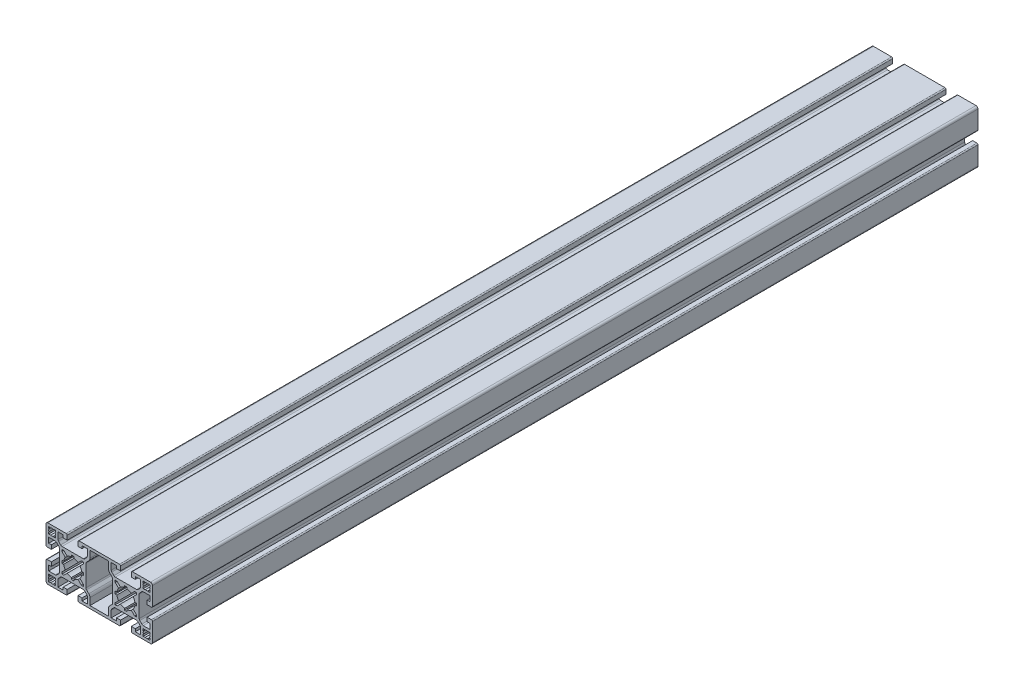
from build123d import *

# Parameters (mm, degrees)
RESSALTO_EXTRUS_O1_DEPTH = 310
SKETCH1_R                = 3
CUT_EXTRUDE1_DEPTH       = 316.119025132


with BuildPart() as part:
    # Esboço1 → Ressalto-extrusão1 (new, symmetric)
    with BuildSketch(Plane.XY):
        with BuildLine():
            Line((-38.5, 20), (-24.85, 20))
            ThreePointArc((-24.85, 20), (-24.284314575, 19.765685425), (-24.05, 19.2))
            Line((-24.05, 19.2), (-24.05, 16))
            Line((-24.05, 16), (-27.05, 16))
            Line((-27.05, 16), (-27.05, 18))
            Line((-27.05, 18), (-31, 18))
            Line((-31, 18), (-31, 13.035533906))
            ThreePointArc((-31, 13.035533906), (-30.885819299, 12.461508757), (-30.560660172, 11.974873734))
            Line((-30.560660172, 11.974873734), (-29.025126266, 10.439339828))
            ThreePointArc((-29.025126266, 10.439339828), (-28.538491243, 10.114180701), (-27.964466094, 10))
            Line((-27.964466094, 10), (-12.035533906, 10))
            ThreePointArc((-12.035533906, 10), (-11.461508757, 10.114180701), (-10.974873734, 10.439339828))
            Line((-10.974873734, 10.439339828), (-9.439339828, 11.974873734))
            ThreePointArc((-9.439339828, 11.974873734), (-9.114180701, 12.461508757), (-9, 13.035533906))
            Line((-9, 13.035533906), (-9, 18))
            Line((-9, 18), (-12.95, 18))
            Line((-12.95, 18), (-12.95, 16))
            Line((-12.95, 16), (-15.95, 16))
            Line((-15.95, 16), (-15.95, 19.2))
            ThreePointArc((-15.95, 19.2), (-15.715685425, 19.765685425), (-15.15, 20))
            Line((-15.15, 20), (15.15, 20))
            ThreePointArc((15.15, 20), (15.715685425, 19.765685425), (15.95, 19.2))
            Line((15.95, 19.2), (15.95, 16))
            Line((15.95, 16), (12.95, 16))
            Line((12.95, 16), (12.95, 18))
            Line((12.95, 18), (9, 18))
            Line((9, 18), (9, 13.035533906))
            ThreePointArc((9, 13.035533906), (9.114180701, 12.461508757), (9.439339828, 11.974873734))
            Line((9.439339828, 11.974873734), (10.974873734, 10.439339828))
            ThreePointArc((10.974873734, 10.439339828), (11.461508757, 10.114180701), (12.035533906, 10))
            Line((12.035533906, 10), (27.964466094, 10))
            ThreePointArc((27.964466094, 10), (28.538491243, 10.114180701), (29.025126266, 10.439339828))
            Line((29.025126266, 10.439339828), (30.560660172, 11.974873734))
            ThreePointArc((30.560660172, 11.974873734), (30.885819299, 12.461508757), (31, 13.035533906))
            Line((31, 13.035533906), (31, 18))
            Line((31, 18), (27.05, 18))
            Line((27.05, 18), (27.05, 16))
            Line((27.05, 16), (24.05, 16))
            Line((24.05, 16), (24.05, 19.2))
            ThreePointArc((24.05, 19.2), (24.284314575, 19.765685425), (24.85, 20))
            Line((24.85, 20), (38.5, 20))
            ThreePointArc((38.5, 20), (39.560660172, 19.560660172), (40, 18.5))
            Line((40, 18.5), (40, 4.85))
            ThreePointArc((40, 4.85), (39.765685425, 4.284314575), (39.2, 4.05))
            Line((39.2, 4.05), (36, 4.05))
            Line((36, 4.05), (36, 7.05))
            Line((36, 7.05), (38, 7.05))
            Line((38, 7.05), (38, 11))
            Line((38, 11), (33.035533906, 11))
            ThreePointArc((33.035533906, 11), (32.461508757, 10.885819299), (31.974873734, 10.560660172))
            Line((31.974873734, 10.560660172), (30.439339828, 9.025126266))
            ThreePointArc((30.439339828, 9.025126266), (30.114180701, 8.538491243), (30, 7.964466094))
            Line((30, 7.964466094), (30, -7.964466094))
            ThreePointArc((30, -7.964466094), (30.114180701, -8.538491243), (30.439339828, -9.025126266))
            Line((30.439339828, -9.025126266), (31.974873734, -10.560660172))
            ThreePointArc((31.974873734, -10.560660172), (32.461508757, -10.885819299), (33.035533906, -11))
            Line((33.035533906, -11), (38, -11))
            Line((38, -11), (38, -7.05))
            Line((38, -7.05), (36, -7.05))
            Line((36, -7.05), (36, -4.05))
            Line((36, -4.05), (39.2, -4.05))
            ThreePointArc((39.2, -4.05), (39.765685425, -4.284314575), (40, -4.85))
            Line((40, -4.85), (40, -18.5))
            ThreePointArc((40, -18.5), (39.560660172, -19.560660172), (38.5, -20))
            Line((38.5, -20), (24.85, -20))
            ThreePointArc((24.85, -20), (24.284314575, -19.765685425), (24.05, -19.2))
            Line((24.05, -19.2), (24.05, -16))
            Line((24.05, -16), (27.05, -16))
            Line((27.05, -16), (27.05, -18))
            Line((27.05, -18), (31, -18))
            Line((31, -18), (31, -13.035533906))
            ThreePointArc((31, -13.035533906), (30.885819299, -12.461508757), (30.560660172, -11.974873734))
            Line((30.560660172, -11.974873734), (29.025126266, -10.439339828))
            ThreePointArc((29.025126266, -10.439339828), (28.538491243, -10.114180701), (27.964466094, -10))
            Line((27.964466094, -10), (12.035533906, -10))
            ThreePointArc((12.035533906, -10), (11.461508757, -10.114180701), (10.974873734, -10.439339828))
            Line((10.974873734, -10.439339828), (9.439339828, -11.974873734))
            ThreePointArc((9.439339828, -11.974873734), (9.114180701, -12.461508757), (9, -13.035533906))
            Line((9, -13.035533906), (9, -18))
            Line((9, -18), (12.95, -18))
            Line((12.95, -18), (12.95, -16))
            Line((12.95, -16), (15.95, -16))
            Line((15.95, -16), (15.95, -19.2))
            ThreePointArc((15.95, -19.2), (15.715685425, -19.765685425), (15.15, -20))
            Line((15.15, -20), (-15.15, -20))
            ThreePointArc((-15.15, -20), (-15.715685425, -19.765685425), (-15.95, -19.2))
            Line((-15.95, -19.2), (-15.95, -16))
            Line((-15.95, -16), (-12.95, -16))
            Line((-12.95, -16), (-12.95, -18))
            Line((-12.95, -18), (-9, -18))
            Line((-9, -18), (-9, -13.035533906))
            ThreePointArc((-9, -13.035533906), (-9.114180701, -12.461508757), (-9.439339828, -11.974873734))
            Line((-9.439339828, -11.974873734), (-10.974873734, -10.439339828))
            ThreePointArc((-10.974873734, -10.439339828), (-11.461508757, -10.114180701), (-12.035533906, -10))
            Line((-12.035533906, -10), (-27.964466094, -10))
            ThreePointArc((-27.964466094, -10), (-28.538491243, -10.114180701), (-29.025126266, -10.439339828))
            Line((-29.025126266, -10.439339828), (-30.560660172, -11.974873734))
            ThreePointArc((-30.560660172, -11.974873734), (-30.885819299, -12.461508757), (-31, -13.035533906))
            Line((-31, -13.035533906), (-31, -18))
            Line((-31, -18), (-27.05, -18))
            Line((-27.05, -18), (-27.05, -16))
            Line((-27.05, -16), (-24.05, -16))
            Line((-24.05, -16), (-24.05, -19.2))
            ThreePointArc((-24.05, -19.2), (-24.284314575, -19.765685425), (-24.85, -20))
            Line((-24.85, -20), (-38.5, -20))
            ThreePointArc((-38.5, -20), (-39.560660172, -19.560660172), (-40, -18.5))
            Line((-40, -18.5), (-40, -4.85))
            ThreePointArc((-40, -4.85), (-39.765685425, -4.284314575), (-39.2, -4.05))
            Line((-39.2, -4.05), (-36, -4.05))
            Line((-36, -4.05), (-36, -7.05))
            Line((-36, -7.05), (-38, -7.05))
            Line((-38, -7.05), (-38, -11))
            Line((-38, -11), (-33.035533906, -11))
            ThreePointArc((-33.035533906, -11), (-32.461508757, -10.885819299), (-31.974873734, -10.560660172))
            Line((-31.974873734, -10.560660172), (-30.439339828, -9.025126266))
            ThreePointArc((-30.439339828, -9.025126266), (-30.114180701, -8.538491243), (-30, -7.964466094))
            Line((-30, -7.964466094), (-30, 7.964466094))
            ThreePointArc((-30, 7.964466094), (-30.114180701, 8.538491243), (-30.439339828, 9.025126266))
            Line((-30.439339828, 9.025126266), (-31.974873734, 10.560660172))
            ThreePointArc((-31.974873734, 10.560660172), (-32.461508757, 10.885819299), (-33.035533906, 11))
            Line((-33.035533906, 11), (-38, 11))
            Line((-38, 11), (-38, 7.05))
            Line((-38, 7.05), (-36, 7.05))
            Line((-36, 7.05), (-36, 4.05))
            Line((-36, 4.05), (-39.2, 4.05))
            ThreePointArc((-39.2, 4.05), (-39.765685425, 4.284314575), (-40, 4.85))
            Line((-40, 4.85), (-40, 18.5))
            ThreePointArc((-40, 18.5), (-39.560660172, 19.560660172), (-38.5, 20))
        make_face()
        with BuildLine():
            Line((-33, 18), (-33, 16.585786438))
            Line((-33, 16.585786438), (-33.172708044, 16.413078393))
            ThreePointArc((-33.172708044, 16.413078393), (-33, 15.5), (-33.172708044, 14.586921606))
            Line((-33.172708044, 14.586921606), (-33, 14.414213562))
            Line((-33, 14.414213562), (-33, 13))
            Line((-33, 13), (-34.414213562, 13))
            Line((-34.414213562, 13), (-34.586921607, 13.172708044))
            ThreePointArc((-34.586921607, 13.172708044), (-35.5, 13), (-36.413078394, 13.172708044))
            Line((-36.413078394, 13.172708044), (-36.585786438, 13))
            Line((-36.585786438, 13), (-38, 13))
            Line((-38, 13), (-38, 14.414213562))
            Line((-38, 14.414213562), (-37.827291956, 14.586921606))
            ThreePointArc((-37.827291956, 14.586921606), (-38, 15.5), (-37.827291956, 16.413078394))
            Line((-37.827291956, 16.413078394), (-38, 16.585786438))
            Line((-38, 16.585786438), (-38, 18))
            Line((-38, 18), (-36.585786438, 18))
            Line((-36.585786438, 18), (-36.413078393, 17.827291956))
            ThreePointArc((-36.413078393, 17.827291956), (-35.5, 18), (-34.586921606, 17.827291956))
            Line((-34.586921606, 17.827291956), (-34.414213562, 18))
            Line((-34.414213562, 18), (-33, 18))
        make_face(mode=Mode.SUBTRACT)
        with BuildLine():
            Line((-28, 6.585786438), (-25.498896635, 4.084683072))
            ThreePointArc((-25.498896635, 4.084683072), (-26.328574798, 2.621381512), (-26.776614199, 1))
            Line((-26.776614199, 1), (-28, 1))
            Line((-28, 1), (-28, -1))
            Line((-28, -1), (-26.776614199, -1))
            ThreePointArc((-26.776614199, -1), (-26.328574798, -2.621381512), (-25.498896635, -4.084683072))
            Line((-25.498896635, -4.084683072), (-28, -6.585786438))
            Line((-28, -6.585786438), (-28, -8))
            Line((-28, -8), (-26.585786438, -8))
            Line((-26.585786438, -8), (-24.084683072, -5.498896635))
            ThreePointArc((-24.084683072, -5.498896635), (-22.621381512, -6.328574798), (-21, -6.776614199))
            Line((-21, -6.776614199), (-21, -8))
            Line((-21, -8), (-19, -8))
            Line((-19, -8), (-19, -6.776614199))
            ThreePointArc((-19, -6.776614199), (-17.378618488, -6.328574798), (-15.915316928, -5.498896635))
            Line((-15.915316928, -5.498896635), (-13.414213562, -8))
            Line((-13.414213562, -8), (-12, -8))
            Line((-12, -8), (-12, -6.585786438))
            Line((-12, -6.585786438), (-14.501103365, -4.084683072))
            ThreePointArc((-14.501103365, -4.084683072), (-13.671425202, -2.621381512), (-13.223385801, -1))
            Line((-13.223385801, -1), (-12, -1))
            Line((-12, -1), (-12, 1))
            Line((-12, 1), (-13.223385801, 1))
            ThreePointArc((-13.223385801, 1), (-13.671425202, 2.621381512), (-14.501103365, 4.084683072))
            Line((-14.501103365, 4.084683072), (-12, 6.585786438))
            Line((-12, 6.585786438), (-12, 8))
            Line((-12, 8), (-13.414213562, 8))
            Line((-13.414213562, 8), (-15.915316928, 5.498896635))
            ThreePointArc((-15.915316928, 5.498896635), (-17.378618488, 6.328574798), (-19, 6.776614199))
            Line((-19, 6.776614199), (-19, 8))
            Line((-19, 8), (-21, 8))
            Line((-21, 8), (-21, 6.776614199))
            ThreePointArc((-21, 6.776614199), (-22.621381512, 6.328574798), (-24.084683072, 5.498896635))
            Line((-24.084683072, 5.498896635), (-26.585786438, 8))
            Line((-26.585786438, 8), (-28, 8))
            Line((-28, 8), (-28, 6.585786438))
        make_face(mode=Mode.SUBTRACT)
        with BuildLine():
            Line((-38, -14.414213562), (-37.827291956, -14.586921606))
            ThreePointArc((-37.827291956, -14.586921606), (-38, -15.5), (-37.827291956, -16.413078394))
            Line((-37.827291956, -16.413078394), (-38, -16.585786438))
            Line((-38, -16.585786438), (-38, -18))
            Line((-38, -18), (-36.585786438, -18))
            Line((-36.585786438, -18), (-36.413078393, -17.827291956))
            ThreePointArc((-36.413078393, -17.827291956), (-35.5, -18), (-34.586921606, -17.827291956))
            Line((-34.586921606, -17.827291956), (-34.414213562, -18))
            Line((-34.414213562, -18), (-33, -18))
            Line((-33, -18), (-33, -16.585786438))
            Line((-33, -16.585786438), (-33.172708044, -16.413078393))
            ThreePointArc((-33.172708044, -16.413078393), (-33, -15.5), (-33.172708044, -14.586921606))
            Line((-33.172708044, -14.586921606), (-33, -14.414213562))
            Line((-33, -14.414213562), (-33, -13))
            Line((-33, -13), (-34.414213562, -13))
            Line((-34.414213562, -13), (-34.586921607, -13.172708044))
            ThreePointArc((-34.586921607, -13.172708044), (-35.5, -13), (-36.413078394, -13.172708044))
            Line((-36.413078394, -13.172708044), (-36.585786438, -13))
            Line((-36.585786438, -13), (-38, -13))
            Line((-38, -13), (-38, -14.414213562))
        make_face(mode=Mode.SUBTRACT)
        with BuildLine():
            Line((-7, 18), (-7, 12.828427125))
            ThreePointArc((-7, 12.828427125), (-7.228361402, 11.680376828), (-7.878679656, 10.707106781))
            Line((-7.878679656, 10.707106781), (-9.560660172, 9.025126266))
            ThreePointArc((-9.560660172, 9.025126266), (-9.885819299, 8.538491243), (-10, 7.964466094))
            Line((-10, 7.964466094), (-10, -7.964466094))
            ThreePointArc((-10, -7.964466094), (-9.885819299, -8.538491243), (-9.560660172, -9.025126266))
            Line((-9.560660172, -9.025126266), (-7.878679656, -10.707106781))
            ThreePointArc((-7.878679656, -10.707106781), (-7.228361402, -11.680376828), (-7, -12.828427125))
            Line((-7, -12.828427125), (-7, -18))
            Line((-7, -18), (7, -18))
            Line((7, -18), (7, -12.828427125))
            ThreePointArc((7, -12.828427125), (7.228361402, -11.680376828), (7.878679656, -10.707106781))
            Line((7.878679656, -10.707106781), (9.560660172, -9.025126266))
            ThreePointArc((9.560660172, -9.025126266), (9.885819299, -8.538491243), (10, -7.964466094))
            Line((10, -7.964466094), (10, 7.964466094))
            ThreePointArc((10, 7.964466094), (9.885819299, 8.538491243), (9.560660172, 9.025126266))
            Line((9.560660172, 9.025126266), (7.878679656, 10.707106781))
            ThreePointArc((7.878679656, 10.707106781), (7.228361402, 11.680376828), (7, 12.828427125))
            Line((7, 12.828427125), (7, 18))
            Line((7, 18), (-7, 18))
        make_face(mode=Mode.SUBTRACT)
        with BuildLine():
            Line((38, 14.414213562), (37.827291956, 14.586921606))
            ThreePointArc((37.827291956, 14.586921606), (38, 15.5), (37.827291956, 16.413078394))
            Line((37.827291956, 16.413078394), (38, 16.585786438))
            Line((38, 16.585786438), (38, 18))
            Line((38, 18), (36.585786438, 18))
            Line((36.585786438, 18), (36.413078393, 17.827291956))
            ThreePointArc((36.413078393, 17.827291956), (35.5, 18), (34.586921606, 17.827291956))
            Line((34.586921606, 17.827291956), (34.414213562, 18))
            Line((34.414213562, 18), (33, 18))
            Line((33, 18), (33, 16.585786438))
            Line((33, 16.585786438), (33.172708044, 16.413078393))
            ThreePointArc((33.172708044, 16.413078393), (33, 15.5), (33.172708044, 14.586921606))
            Line((33.172708044, 14.586921606), (33, 14.414213562))
            Line((33, 14.414213562), (33, 13))
            Line((33, 13), (34.414213562, 13))
            Line((34.414213562, 13), (34.586921607, 13.172708044))
            ThreePointArc((34.586921607, 13.172708044), (35.5, 13), (36.413078394, 13.172708044))
            Line((36.413078394, 13.172708044), (36.585786438, 13))
            Line((36.585786438, 13), (38, 13))
            Line((38, 13), (38, 14.414213562))
        make_face(mode=Mode.SUBTRACT)
        with BuildLine():
            Line((28, 1), (26.776614199, 1))
            ThreePointArc((26.776614199, 1), (26.328574798, 2.621381512), (25.498896635, 4.084683072))
            Line((25.498896635, 4.084683072), (28, 6.585786438))
            Line((28, 6.585786438), (28, 8))
            Line((28, 8), (26.585786438, 8))
            Line((26.585786438, 8), (24.084683072, 5.498896635))
            ThreePointArc((24.084683072, 5.498896635), (22.621381512, 6.328574798), (21, 6.776614199))
            Line((21, 6.776614199), (21, 8))
            Line((21, 8), (19, 8))
            Line((19, 8), (19, 6.776614199))
            ThreePointArc((19, 6.776614199), (17.378618488, 6.328574798), (15.915316928, 5.498896635))
            Line((15.915316928, 5.498896635), (13.414213562, 8))
            Line((13.414213562, 8), (12, 8))
            Line((12, 8), (12, 6.585786438))
            Line((12, 6.585786438), (14.501103365, 4.084683072))
            ThreePointArc((14.501103365, 4.084683072), (13.671425202, 2.621381512), (13.223385801, 1))
            Line((13.223385801, 1), (12, 1))
            Line((12, 1), (12, -1))
            Line((12, -1), (13.223385801, -1))
            ThreePointArc((13.223385801, -1), (13.671425202, -2.621381512), (14.501103365, -4.084683072))
            Line((14.501103365, -4.084683072), (12, -6.585786438))
            Line((12, -6.585786438), (12, -8))
            Line((12, -8), (13.414213562, -8))
            Line((13.414213562, -8), (15.915316928, -5.498896635))
            ThreePointArc((15.915316928, -5.498896635), (17.378618488, -6.328574798), (19, -6.776614199))
            Line((19, -6.776614199), (19, -8))
            Line((19, -8), (21, -8))
            Line((21, -8), (21, -6.776614199))
            ThreePointArc((21, -6.776614199), (22.621381512, -6.328574798), (24.084683072, -5.498896635))
            Line((24.084683072, -5.498896635), (26.585786438, -8))
            Line((26.585786438, -8), (28, -8))
            Line((28, -8), (28, -6.585786438))
            Line((28, -6.585786438), (25.498896635, -4.084683072))
            ThreePointArc((25.498896635, -4.084683072), (26.328574798, -2.621381512), (26.776614199, -1))
            Line((26.776614199, -1), (28, -1))
            Line((28, -1), (28, 1))
        make_face(mode=Mode.SUBTRACT)
        with BuildLine():
            Line((33, -18), (33, -16.585786438))
            Line((33, -16.585786438), (33.172708044, -16.413078393))
            ThreePointArc((33.172708044, -16.413078393), (33, -15.5), (33.172708044, -14.586921606))
            Line((33.172708044, -14.586921606), (33, -14.414213562))
            Line((33, -14.414213562), (33, -13))
            Line((33, -13), (34.414213562, -13))
            Line((34.414213562, -13), (34.586921607, -13.172708044))
            ThreePointArc((34.586921607, -13.172708044), (35.5, -13), (36.413078394, -13.172708044))
            Line((36.413078394, -13.172708044), (36.585786438, -13))
            Line((36.585786438, -13), (38, -13))
            Line((38, -13), (38, -14.414213562))
            Line((38, -14.414213562), (37.827291956, -14.586921606))
            ThreePointArc((37.827291956, -14.586921606), (38, -15.5), (37.827291956, -16.413078394))
            Line((37.827291956, -16.413078394), (38, -16.585786438))
            Line((38, -16.585786438), (38, -18))
            Line((38, -18), (36.585786438, -18))
            Line((36.585786438, -18), (36.413078393, -17.827291956))
            ThreePointArc((36.413078393, -17.827291956), (35.5, -18), (34.586921606, -17.827291956))
            Line((34.586921606, -17.827291956), (34.414213562, -18))
            Line((34.414213562, -18), (33, -18))
        make_face(mode=Mode.SUBTRACT)
    extrude(amount=RESSALTO_EXTRUS_O1_DEPTH, both=True)

    # Sketch1 → Cut-Extrude1 (cut, through all)
    with BuildSketch(Plane(origin=(0, 20, 0), x_dir=(1, 0, 0), z_dir=(0, 1, 0))):
        with Locations((19.77161995, 243.5)):
            Circle(SKETCH1_R)
        with Locations((-19.77161995, 243.5)):
            Circle(SKETCH1_R)
        with Locations((19.77161995, -243.5)):
            Circle(SKETCH1_R)
        with Locations((-19.77161995, -243.5)):
            Circle(SKETCH1_R)
        with Locations((19.77161995, 296.5)):
            Circle(SKETCH1_R)
        with Locations((-19.77161995, 296.5)):
            Circle(SKETCH1_R)
        with Locations((19.77161995, -296.5)):
            Circle(SKETCH1_R)
        with Locations((-19.77161995, -296.5)):
            Circle(SKETCH1_R)
    extrude(amount=-CUT_EXTRUDE1_DEPTH, mode=Mode.SUBTRACT)


solid = part.part
